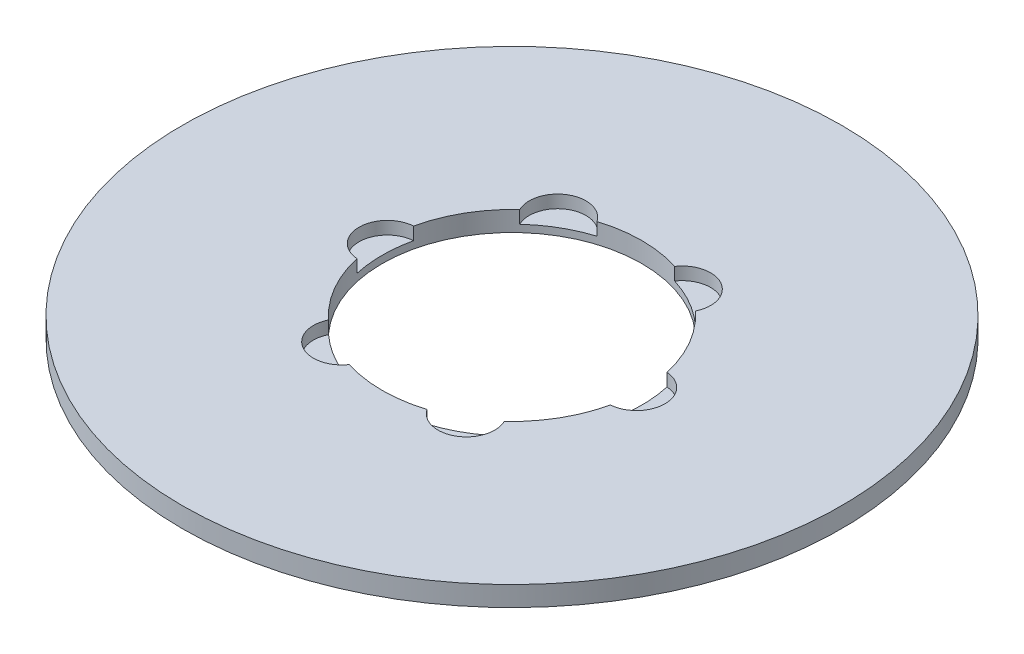
from build123d import *

# Parameters (mm, degrees)
SKETCH1_R           = 82.5
BOSS_EXTRUDE1_DEPTH = 5
SKETCH2_R           = 32.5
CUT_EXTRUDE1_DEPTH  = 117.779707141
SKETCH3_R           = 7.107552058
CUT_EXTRUDE2_DEPTH  = 3.181232789
CIRPATTERN1_COUNT   = 6


with BuildPart() as part:
    # Sketch1 → Boss-Extrude1 (new body)
    with BuildSketch(Plane(origin=(0, 0, 0), x_dir=(1, 0, 0), z_dir=(0, 1, 0))):
        Circle(SKETCH1_R)
    extrude(amount=BOSS_EXTRUDE1_DEPTH)

    # Sketch2 → Cut-Extrude1 (cut, through all)
    with BuildSketch(Plane(origin=(0, 0, 0), x_dir=(1, 0, 0), z_dir=(0, 1, 0))):
        Circle(SKETCH2_R)
    extrude(amount=CUT_EXTRUDE1_DEPTH, mode=Mode.SUBTRACT)

    # Sketch3 → Cut-Extrude2 (cut)
    with BuildSketch(Plane(origin=(0, 5, 0), x_dir=(1, 0, 0), z_dir=(0, 1, 0))):
        with Locations((-31.189195256, 0)):
            Circle(SKETCH3_R)
    cut_extrude2 = extrude(amount=-CUT_EXTRUDE2_DEPTH, mode=Mode.SUBTRACT)

    # CirPattern1: Cut-Extrude2 ×6 about axis
    cirpattern1_axis = Axis((0, 0, 0), (0, 1, 0))
    for i in range(1, CIRPATTERN1_COUNT):
        add(cut_extrude2.rotate(cirpattern1_axis, i * 360 / CIRPATTERN1_COUNT), mode=Mode.SUBTRACT)


solid = part.part
